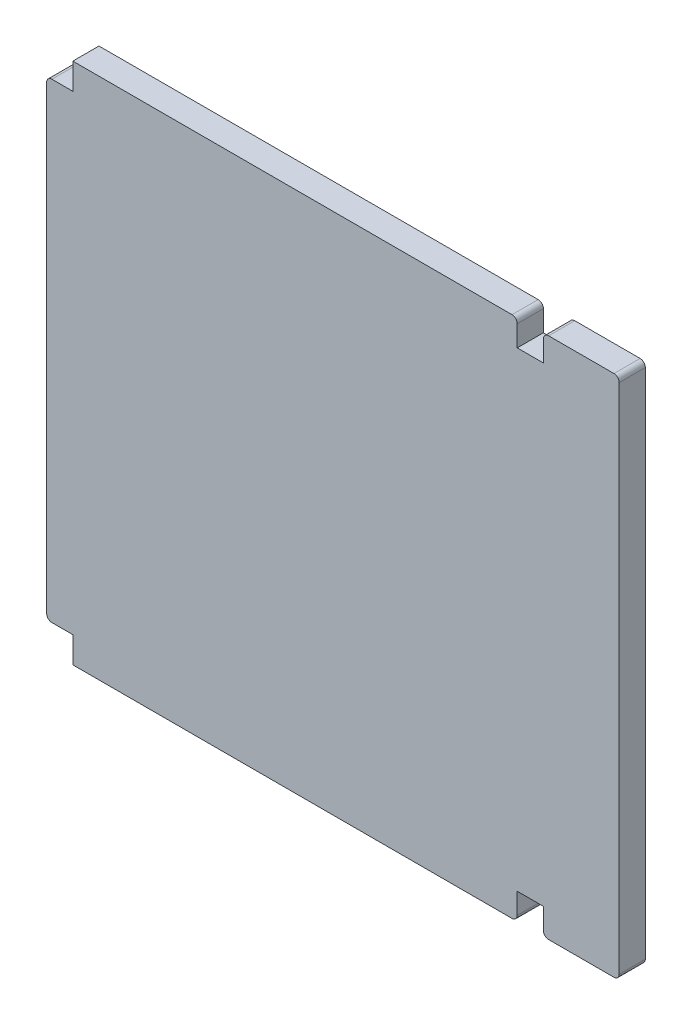
from build123d import *

# Parameters (mm, degrees)
BOSS_EXTRUDE1_DEPTH = 5
FILLET1_R           = 1


with BuildPart() as part:
    # Sketch1 → Boss-Extrude1 (new body)
    with BuildSketch(Plane.XY):
        Polygon((0, 95), (0, 100), (85, 100), (85, 95), (90, 95), (90, 100), (104.5, 100), (104.5, 0), (90, 0), (90, 5), (85, 5), (85, 0), (0, 0), (0, 5), (-5, 5), (-5, 95), align=None)
    extrude(amount=BOSS_EXTRUDE1_DEPTH)

    # Fillet1
    fillet1_edges = [part.edges().sort_by_distance(p)[0] for p in [
        (104.5, 0, 2.5),
        (104.5, 100, 2.5),
        (85, 100, 2.5),
        (90, 100, 2.5),
        (-5, 95, 2.5),
        (-5, 5, 2.5),
        (85, 0, 2.5),
        (90, 0, 2.5),
    ]]
    fillet(fillet1_edges, radius=FILLET1_R)


solid = part.part
